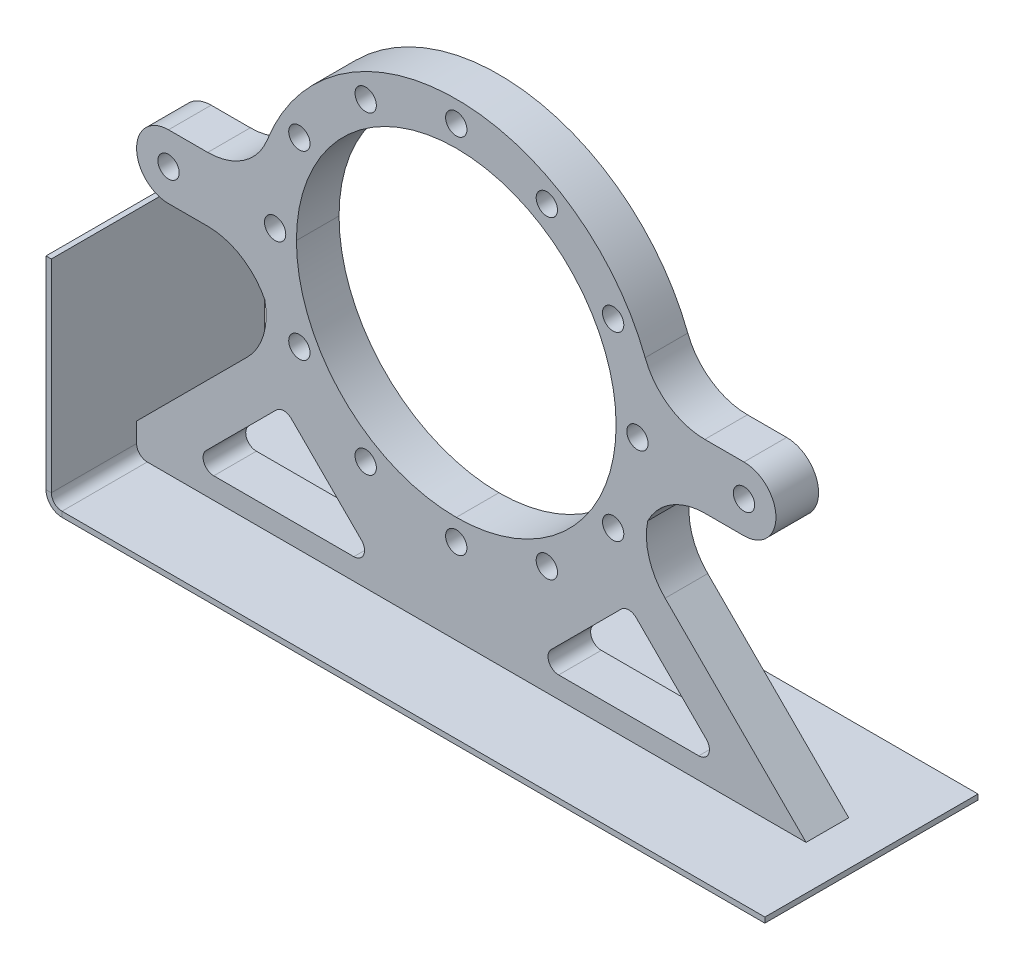
from build123d import *

# Parameters (mm, degrees)
BOSS_EXTRUDE2_DEPTH      = 25.4
BOSS_EXTRUDE2_DEPTH_BACK = 25.4
SKETCH1_R                = 241.3
SKETCH1_R_2              = 12.7
SKETCH1_R_3              = 190.5
SKETCH1_R_4              = 38.1
FILLET1_R                = 76.2
CUT_EXTRUDE1_DEPTH       = 127
FILLET2_R                = 12.7
FILLET2_OF_MIRROR2_R     = 12.7
CONVERT_SOLID2_START     = -127
CONVERT_SOLID2_DEPTH     = 254
FILLET3_R                = 12.7


# Read off the part's stored shape, not the designer's step: Convert-Solid2
with BuildPart() as part:
    # Sketch1 → Boss-Extrude2 (new, two sides: drawn at the far end of the back side and taken through both)
    # profile 1 of 6: a face of its own
    with BuildSketch(Plane.XY.offset(-BOSS_EXTRUDE2_DEPTH_BACK)):
        with BuildLine():
            Line((416.921024484, -317.5), (212.933396583, -113.512372099))
            ThreePointArc((212.933396583, -113.512372099), (0, -241.3), (-212.933396583, -113.512372099))
            Line((-212.933396583, -113.512372099), (-381, -281.578975516))
            Line((-381, -281.578975516), (-381, -317.5))
            Line((-381, -317.5), (416.921024484, -317.5))
        make_face()
    # profile 2 of 6: a face of its own
    with BuildSketch(Plane.XY.offset(-BOSS_EXTRUDE2_DEPTH_BACK)):
        Circle(SKETCH1_R)
        with Locations((186.974884677, 107.95)):
            Circle(SKETCH1_R_2, mode=Mode.SUBTRACT)
        with Locations((107.95, 186.974884677)):
            Circle(SKETCH1_R_2, mode=Mode.SUBTRACT)
        with Locations((0, 215.9)):
            Circle(SKETCH1_R_2, mode=Mode.SUBTRACT)
        with Locations((-107.95, 186.974884677)):
            Circle(SKETCH1_R_2, mode=Mode.SUBTRACT)
        with Locations((-186.974884677, 107.95)):
            Circle(SKETCH1_R_2, mode=Mode.SUBTRACT)
        with Locations((-215.9, 0)):
            Circle(SKETCH1_R_2, mode=Mode.SUBTRACT)
        with Locations((-186.974884677, -107.95)):
            Circle(SKETCH1_R_2, mode=Mode.SUBTRACT)
        with Locations((-107.95, -186.974884677)):
            Circle(SKETCH1_R_2, mode=Mode.SUBTRACT)
        with Locations((0, -215.9)):
            Circle(SKETCH1_R_2, mode=Mode.SUBTRACT)
        with Locations((107.95, -186.974884677)):
            Circle(SKETCH1_R_2, mode=Mode.SUBTRACT)
        with Locations((186.974884677, -107.95)):
            Circle(SKETCH1_R_2, mode=Mode.SUBTRACT)
        with Locations((215.9, 0)):
            Circle(SKETCH1_R_2, mode=Mode.SUBTRACT)
        Circle(SKETCH1_R_3, mode=Mode.SUBTRACT)
    # profile 3 of 6: a face of its own
    with BuildSketch(Plane.XY.offset(-BOSS_EXTRUDE2_DEPTH_BACK)):
        with BuildLine():
            ThreePointArc((342.9, -38.1), (304.8, 0), (342.9, 38.1))
            Line((342.9, 38.1), (238.273120599, 38.1))
            ThreePointArc((238.273120599, 38.1), (240.542089873, 19.110023541), (241.3, 0))
            ThreePointArc((241.3, 0), (240.542089873, -19.110023541), (238.273120599, -38.1))
            Line((238.273120599, -38.1), (342.9, -38.1))
        make_face()
    # profile 4 of 6: a face of its own
    with BuildSketch(Plane.XY.offset(-BOSS_EXTRUDE2_DEPTH_BACK)):
        with Locations((342.9, 0)):
            Circle(SKETCH1_R_4)
        with Locations((342.9, 0)):
            Circle(SKETCH1_R_2, mode=Mode.SUBTRACT)
    # profile 5 of 6: a face of its own
    with BuildSketch(Plane.XY.offset(-BOSS_EXTRUDE2_DEPTH_BACK)):
        with BuildLine():
            ThreePointArc((-238.273120599, -38.1), (-241.3, 0), (-238.273120599, 38.1))
            Line((-238.273120599, 38.1), (-342.9, 38.1))
            ThreePointArc((-342.9, 38.1), (-315.959231637, 26.940768363), (-304.8, 0))
            ThreePointArc((-304.8, 0), (-315.959231637, -26.940768363), (-342.9, -38.1))
            Line((-342.9, -38.1), (-238.273120599, -38.1))
        make_face()
    # profile 6 of 6: a face of its own
    with BuildSketch(Plane.XY.offset(-BOSS_EXTRUDE2_DEPTH_BACK)):
        with Locations((-342.9, 0)):
            Circle(SKETCH1_R_4)
        with Locations((-342.9, 0)):
            Circle(SKETCH1_R_2, mode=Mode.SUBTRACT)
    extrude(amount=BOSS_EXTRUDE2_DEPTH + BOSS_EXTRUDE2_DEPTH_BACK)

    # Fillet1
    # the kernel refuses this fillet: 76.2 mm, written as the material it adds along each edge
    with BuildSketch(Plane(origin=(-212.933396583, -113.512372099, -25.4), x_dir=(-0.7071067811865457, -0.7071067811865493, 0), z_dir=(0, 0, 1))) as fillet1_piece_1:
        with BuildLine():
            CenterArc((50.847987502, -76.2), FILLET1_R, 90, 62.521136884)
            ThreePointArc((-16.755213513, -41.039692655), (-7.433206057, -20.905415379), (0, 0))
            Line((0, 0), (50.847987502, 0))
        make_face()
    extrude(amount=50.8)
    with BuildSketch(Plane(origin=(-238.273120599, -38.1, -25.4), x_dir=(0.2603774212103102, -0.9655069127271274, 0), z_dir=(0, 0, 1)), Plane(origin=(238.273120599, 38.1, -25.4), x_dir=(-0.26037742121031, 0.9655069127271273, 0), z_dir=(0, 0, 1)), Plane(origin=(238.273120599, -38.1, 25.4), x_dir=(-0.26037742121030977, -0.9655069127271274, 0), z_dir=(0, 0, -1))) as fillet1_piece_2:
        with BuildLine():
            CenterArc((58.485557982, -75.781492043), FILLET1_R, 96.007737868, 68.899803976)
            Line((-15.086068768, -55.940732547), (0, 0))
            ThreePointArc((0, 0), (25.25512731, -1.325275196), (50.510254621, 0))
        make_face()
    extrude(amount=50.8)
    with BuildSketch(Plane(origin=(-238.273120599, 38.1, -25.4), x_dir=(-1, 0, 0), z_dir=(0, 0, 1))) as fillet1_piece_3:
        with BuildLine():
            CenterArc((57.939235659, -76.2), FILLET1_R, 90, 68.899803976)
            ThreePointArc((-13.151729843, -48.768), (-5.296302558, -24.729071738), (0, 0))
            Line((0, 0), (57.939235659, 0))
        make_face()
    extrude(amount=50.8)
    with BuildSketch(Plane(origin=(212.933396583, -113.512372099, 25.4), x_dir=(0.38737646378899676, 0.921921621019017, 0), z_dir=(0, 0, -1))) as fillet1_piece_4:
        with BuildLine():
            CenterArc((51.327444821, 75.877870562), FILLET1_R, 202.208646499, 62.521136884)
            Line((-19.219548021, 47.075756041), (0, 0))
            ThreePointArc((0, 0), (22.1641239, 1.020076553), (44.3282478, 0))
        make_face()
    extrude(amount=50.8)

    # Sketch4 → Cut-Extrude1 (cut)
    with BuildSketch(Plane.XY.offset(25.4)):
        Polygon((-319.678975516, -292.1), (-205.52415932, -177.945183804), (-91.369343124, -292.1), align=None)
    cut_extrude1 = extrude(amount=-CUT_EXTRUDE1_DEPTH, mode=Mode.SUBTRACT)

    # Fillet2
    fillet2_edges = [part.edges().sort_by_distance(p)[0] for p in [
        (-91.369343124, -292.1, 0),
        (-319.678975516, -292.1, 0),
        (-205.52415932, -177.945183804, 0),
    ]]
    fillet(fillet2_edges, radius=FILLET2_R)

    # Mirror2: Cut-Extrude1 across plane
    add(cut_extrude1.mirror(Plane(origin=(0, 0, 0), x_dir=(0, 0, 1), z_dir=(1, 0, 0))), mode=Mode.SUBTRACT)

    # Fillet2 of Mirror2
    fillet2_of_mirror2_edges = [part.edges().sort_by_distance(p)[0] for p in [
        (91.369343124, -292.1, 0),
        (319.678975516, -292.1, 0),
        (205.52415932, -177.945183804, 0),
    ]]
    fillet(fillet2_of_mirror2_edges, radius=FILLET2_OF_MIRROR2_R)

    # Fillet3
    fillet3_edges = [part.edges().sort_by_distance(p)[0] for p in [
        (-381, -317.5, 0),
    ]]
    fillet(fillet3_edges, radius=FILLET3_R)


with BuildPart() as body_2:
    # Convert-Solid2 outline → Convert-Solid2 (new body)
    with BuildSketch(Plane.XY.offset(CONVERT_SOLID2_START)):
        with BuildLine():
            Line((469.392, -323.85), (469.392, -317.5))
            Line((469.392, -317.5), (-368.3, -317.5))
            ThreePointArc((-368.3, -317.5), (-377.280256121, -313.780256121), (-381, -304.8))
            Line((-381, -304.8), (-381, -63.5))
            Line((-381, -63.5), (-387.35, -63.5))
            Line((-387.35, -63.5), (-387.35, -304.8))
            ThreePointArc((-387.35, -304.8), (-381.770384182, -318.270384182), (-368.3, -323.85))
            Line((-368.3, -323.85), (469.392, -323.85))
        make_face()
    extrude(amount=CONVERT_SOLID2_DEPTH)


solid = Compound([part.part, body_2.part])
